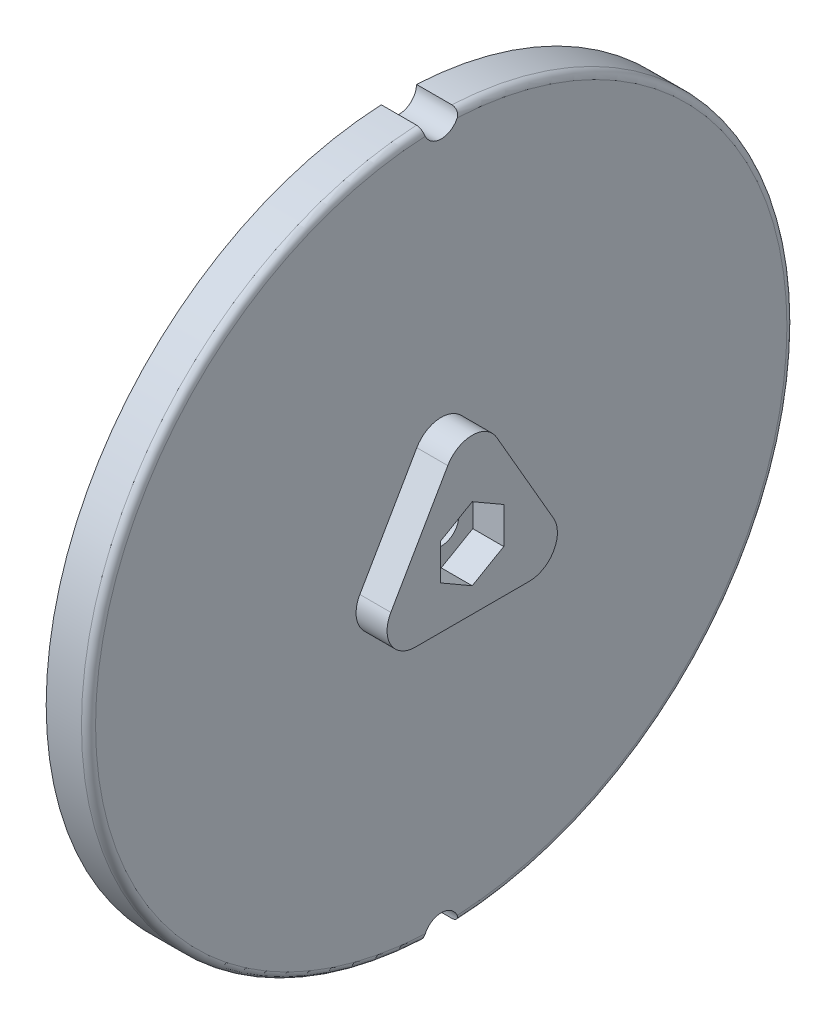
from build123d import *

# Parameters (mm, degrees)
SKETCH2_R           = 3.175
BOSS_EXTRUDE1_DEPTH = 7.62
BOSS_EXTRUDE2_DEPTH = 5.58
FILLET1_R           = 5.08
FILLET3_R           = 1.27


with BuildPart() as part:
    # Sketch2 → Boss-Extrude1 (new body)
    with BuildSketch(Plane(origin=(0, 0, 0), x_dir=(0, 0, -1), z_dir=(1, 0, 0))):
        with BuildLine():
            ThreePointArc((3.174202727, -63.420615237), (63.5, 0), (3.174202727, 63.420615237))
            ThreePointArc((3.174202727, 63.420615237), (0.000185525, 60.324999039), (-3.173812636, 63.42063476))
            ThreePointArc((-3.173812636, 63.42063476), (-63.5, 0), (-3.173812636, -63.42063476))
            ThreePointArc((-3.173812636, -63.42063476), (0.000185525, -60.324999039), (3.174202727, -63.420615237))
        make_face()
        Circle(SKETCH2_R, mode=Mode.SUBTRACT)
    extrude(amount=BOSS_EXTRUDE1_DEPTH)

    # Sketch3 → Boss-Extrude2 (add)
    with BuildSketch(Plane(origin=(7.62, 0, 0), x_dir=(0, 0, -1), z_dir=(1, 0, 0))):
        Polygon((19.05, -10.998522628), (0, 21.997045256), (-19.05, -10.998522628), align=None)
        Polygon((-5.675, 3.276462778), (-5.675, -3.276462778), (0, -6.552925555), (5.675, -3.276462778), (5.675, 3.276462778), (0, 6.552925555), align=None, mode=Mode.SUBTRACT)
    extrude(amount=BOSS_EXTRUDE2_DEPTH)

    # Fillet1
    fillet1_edges = [part.edges().sort_by_distance(p)[0] for p in [
        (10.41, -10.998522628, -19.05),
        (10.41, 21.997045256, 0),
        (10.41, -10.998522628, 19.05),
    ]]
    fillet(fillet1_edges, radius=FILLET1_R)

    # Fillet3
    fillet3_edges = [part.edges().sort_by_distance(p)[0] for p in [
        (7.62, 0, -63.5),
        (7.62, 0, 63.5),
    ]]
    fillet(fillet3_edges, radius=FILLET3_R)


solid = part.part
